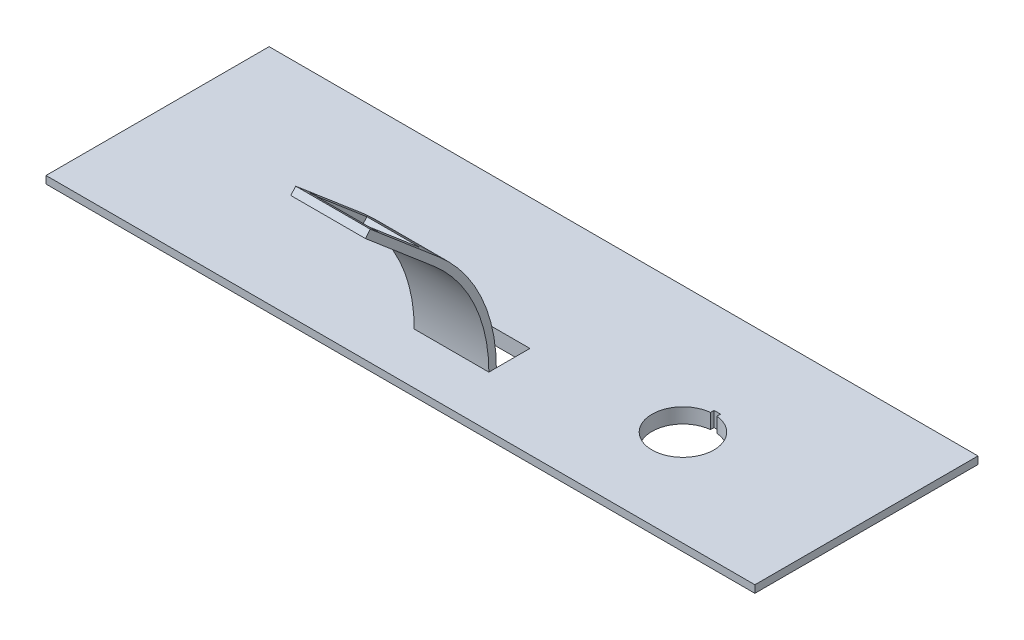
from build123d import *

# Parameters (mm, degrees)
SKETCH1_W                = 234.95
SKETCH1_H                = 69.596
BOSS_EXTRUDE1_DEPTH      = 2.54
SKETCH2_W                = 241.3
SKETCH2_H                = 75.946
BOSS_EXTRUDE2_DEPTH      = 2.54
SKETCH3_W                = 25.4
SKETCH3_H                = 11.43
CUT_EXTRUDE2_DEPTH       = 127.5866408
BOSS_EXTRUDE7_DEPTH      = 12.7
BOSS_EXTRUDE7_DEPTH_BACK = 12.7
SKETCH5_W                = 25.4
SKETCH5_H                = 2.54
BOSS_EXTRUDE8_DEPTH      = 30.48
CUT_EXTRUDE3_REACH       = 153.329
SKETCH6_W                = 18.288
SKETCH6_H                = 23.01875
CUT_EXTRUDE4_REACH       = 153.329
SKETCH9_R                = 1
CUT_EXTRUDE6_REACH       = 151.523


with BuildPart() as part:
    # Sketch1 → Boss-Extrude1 (new body)
    with BuildSketch(Plane(origin=(0, 0, 0), x_dir=(1, 0, 0), z_dir=(0, 1, 0))):
        Rectangle(SKETCH1_W, SKETCH1_H)
    extrude(amount=BOSS_EXTRUDE1_DEPTH)

    # Sketch2 → Boss-Extrude2 (add)
    with BuildSketch(Plane(origin=(0, 2.54, 0), x_dir=(1, 0, 0), z_dir=(0, 1, 0))):
        Rectangle(SKETCH2_W, SKETCH2_H)
    extrude(amount=BOSS_EXTRUDE2_DEPTH)

    # Sketch3 → Cut-Extrude2 (cut, through all)
    with BuildSketch(Plane(origin=(0, 5.08, 0), x_dir=(1, 0, 0), z_dir=(0, 1, 0))):
        with Locations((0, -12.319)):
            Rectangle(SKETCH3_W, SKETCH3_H)
    extrude(amount=-CUT_EXTRUDE2_DEPTH, mode=Mode.SUBTRACT)

    # Sketch4 → Boss-Extrude7 (add, two sides: drawn at the far end of the back side and taken through both)
    with BuildSketch(Plane(origin=(0, 0, 0), x_dir=(0, 0, -1), z_dir=(1, 0, 0)).offset(-BOSS_EXTRUDE7_DEPTH_BACK)):
        with BuildLine():
            ThreePointArc((-18.034, 5.08), (-23.194025065, 28.533326897), (-37.721134665, 47.655238095))
            Line((-37.721134665, 47.655238095), (-39.366264908, 45.72))
            ThreePointArc((-39.366264908, 45.72), (-25.499478471, 27.467266584), (-20.574, 5.08))
            Line((-20.574, 5.08), (-18.034, 5.08))
        make_face()
    extrude(amount=BOSS_EXTRUDE7_DEPTH + BOSS_EXTRUDE7_DEPTH_BACK)

    # Sketch5 → Boss-Extrude8 (add)
    with BuildSketch(Plane(origin=(0, 38.605953422, 45.413858329), x_dir=(1, 0, 0), z_dir=(0, 0.6476890718445453, 0.7619047619047618))):
        with Locations((0, 10.607186134)):
            Rectangle(SKETCH5_W, SKETCH5_H)
    extrude(amount=BOSS_EXTRUDE8_DEPTH)

    # Sketch6 → Cut-Extrude3 (cut, up to next)
    with BuildSketch(Plane(origin=(0, 9.049284674, -7.692723663), x_dir=(1, 0, 0), z_dir=(0, 0.7619047619047618, -0.6476890718445453)), mode=Mode.PRIVATE) as cut_extrude3_sk1:
        with Locations((0, -74.455715595)):
            Rectangle(SKETCH6_W, SKETCH6_H)
    cut_extrude3_tool1 = extrude(cut_extrude3_sk1.sketch, amount=-CUT_EXTRUDE3_REACH, mode=Mode.PRIVATE) & part.part
    add(cut_extrude3_tool1.solids().sort_by_distance((0, 57.273438, 49.035441))[0], mode=Mode.SUBTRACT)

    # Sketch9 → Cut-Extrude4 (cut, up to next)
    with BuildSketch(Plane(origin=(0, 9.049284674, -7.692723663), x_dir=(1, 0, 0), z_dir=(0, 0.7619047619047618, -0.6476890718445453)), mode=Mode.PRIVATE) as cut_extrude4_sk1:
        with Locations((-10.31875, -85.171340595)):
            Circle(SKETCH9_R)
    cut_extrude4_tool1 = extrude(cut_extrude4_sk1.sketch, amount=-CUT_EXTRUDE4_REACH, mode=Mode.PRIVATE) & part.part
    # Sketch9 → Cut-Extrude4 (cut, up to next)
    with BuildSketch(Plane(origin=(0, 9.049284674, -7.692723663), x_dir=(1, 0, 0), z_dir=(0, 0.7619047619047618, -0.6476890718445453)), mode=Mode.PRIVATE) as cut_extrude4_sk2:
        with Locations((10.31875, -85.171340595)):
            Circle(SKETCH9_R)
    cut_extrude4_tool2 = extrude(cut_extrude4_sk2.sketch, amount=-CUT_EXTRUDE4_REACH, mode=Mode.PRIVATE) & part.part
    add(cut_extrude4_tool1.solids().sort_by_distance((-10.31875, 64.213831, 57.199726))[0], mode=Mode.SUBTRACT)
    add(cut_extrude4_tool2.solids().sort_by_distance((10.31875, 64.213831, 57.199726))[0], mode=Mode.SUBTRACT)

    # Sketch10 → Cut-Extrude6 (cut, up to next)
    with BuildSketch(Plane(origin=(0, 5.08, 0), x_dir=(1, 0, 0), z_dir=(0, 1, 0)), mode=Mode.PRIVATE) as cut_extrude6_sk1:
        with BuildLine():
            Line((62.300670098, 6.472268969), (64.500670098, 6.472268969))
            Line((64.500670098, 6.472268969), (64.500670098, 5.272268969))
            ThreePointArc((64.500670098, 5.272268969), (63.400670098, -15.752178985), (62.300670098, 5.272268969))
            Line((62.300670098, 5.272268969), (62.300670098, 6.472268969))
        make_face()
    cut_extrude6_tool1 = extrude(cut_extrude6_sk1.sketch, amount=-CUT_EXTRUDE6_REACH, mode=Mode.PRIVATE) & part.part
    add(cut_extrude6_tool1.solids().sort_by_distance((63.40067, 5.08, 5.130488))[0], mode=Mode.SUBTRACT)


solid = part.part
